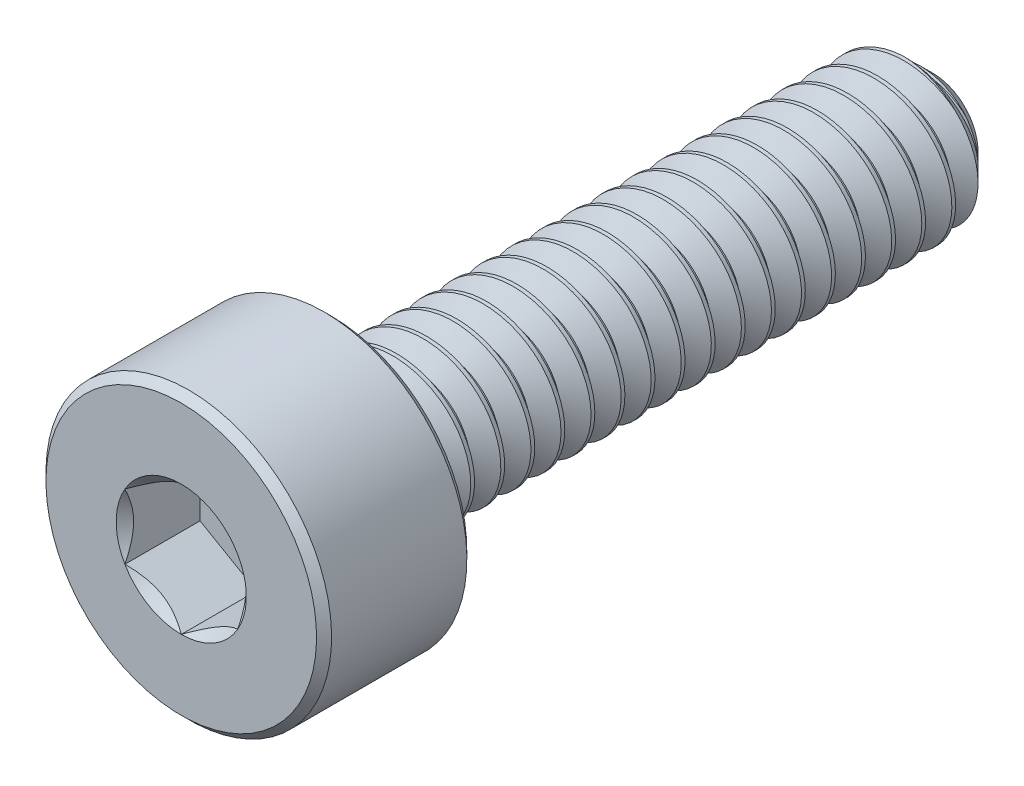
from build123d import *

# Parameters (mm, degrees)
CUT_EXTRUDE1_DEPTH = 1
CUT_SWEEP1_PITCH   = 0.4


# Read off the part's stored shape, not the designer's step: Split1, Boss-Extrude1
with BuildPart() as part:
    # Sketch2 → Revolve1 (revolve)
    with BuildSketch(Plane(origin=(0, 0, 0), x_dir=(0, 0, -1), z_dir=(1, 0, 0))):
        Polygon((-5, 0), (-5, 1.8), (-4.9, 1.9), (-3.1, 1.9), (-3, 1.8), (-3, 1), (4.6, 1), (5, 0.6), (5, 0), align=None)
    revolve(axis=Axis((0, 0, -5), (0, 0, 1)))

    # Sketch3 → Cut-Extrude1 (cut)
    with BuildSketch(Plane.XY.offset(5)):
        Polygon((0.75, -0.433012702), (0.75, 0.433012702), (0, 0.866025404), (-0.75, 0.433012702), (-0.75, -0.433012702), (0, -0.866025404), align=None)
    extrude(amount=-CUT_EXTRUDE1_DEPTH, mode=Mode.SUBTRACT)

    # Cut-Extrude2 cone 1 section (through the dimple's axis) → Cut-Extrude2 (revolve, cut)
    with BuildSketch(Plane(origin=(0, 0, 5), x_dir=(0, -1, 0), z_dir=(1, 0, 0))):
        Polygon((0, 0), (0.866025404, 0), (0, 0.866025404), align=None)
    revolve(axis=Axis((0, 0, 5), (0, 0, -1)), mode=Mode.SUBTRACT)


with BuildPart() as body_2:
    # Split1: the piece on the far side of the plane
    add(part.part)
    split(bisect_by=Plane.XY.offset(3), keep=Keep.BOTTOM)

    # Cut-Sweep1: the profile of Sketch7 screwed along a right-hand helix of 21.15 turns, 6 arcs to a turn; built about Z, then put on its axis
    cut_sweep1_z = Axis((0, 0, 0), (0, 0, 1))
    cut_sweep1_corners = [(1.021650635, 0, 0.0125), (1.021650635, 0, -0.3625), (0.740192379, 0, -0.2), (0.740192379, 0, -0.15)]
    with BuildLine(mode=Mode.PRIVATE) as cut_sweep1_profile:
        Line(cut_sweep1_corners[0], cut_sweep1_corners[1])
        Line(cut_sweep1_corners[1], cut_sweep1_corners[2])
        Line(cut_sweep1_corners[2], cut_sweep1_corners[3])
        Line(cut_sweep1_corners[3], cut_sweep1_corners[0])
    cut_sweep1_cap = Face(cut_sweep1_profile.wire())
    cut_sweep1_turn_angles = [0, 30, 60, 90, 120, 150, 180, 210, 240, 270, 300, 330, 360]
    cut_sweep1_turn_weights = [1, 0.8660254037844387, 1, 0.8660254037844387, 1, 0.8660254037844387, 1, 0.8660254037844387, 1, 0.8660254037844387, 1, 0.8660254037844387, 1]
    cut_sweep1_turn_rails = [Edge.make_bspline([Vector(p[0], p[1], 0).rotate(cut_sweep1_z, cut_sweep1_turn_angles[k]) / cut_sweep1_turn_weights[k] + Vector(0, 0, p[2] + CUT_SWEEP1_PITCH * cut_sweep1_turn_angles[k] / 360) for k in range(13)], [0, 0, 0, 1, 1, 2, 2, 3, 3, 4, 4, 5, 5, 6, 6, 6], 2, cut_sweep1_turn_weights) for p in cut_sweep1_corners]
    cut_sweep1_turn_sides = [Face.make_surface_from_curves(cut_sweep1_turn_rails[p[0]], cut_sweep1_turn_rails[p[1]]) for p in [(0, 1), (1, 2), (2, 3), (3, 0)]]
    cut_sweep1_last_angles = [7560, 7587, 7614]
    cut_sweep1_last_weights = [1, 0.8910065241884868, 1]
    cut_sweep1_last_rails = [Edge.make_bspline([Vector(p[0], p[1], 0).rotate(cut_sweep1_z, cut_sweep1_last_angles[k]) / cut_sweep1_last_weights[k] + Vector(0, 0, p[2] + CUT_SWEEP1_PITCH * cut_sweep1_last_angles[k] / 360) for k in range(3)], [0, 0, 0, 1, 1, 1], 2, cut_sweep1_last_weights) for p in cut_sweep1_corners]
    cut_sweep1_last_sides = [Face.make_surface_from_curves(cut_sweep1_last_rails[p[0]], cut_sweep1_last_rails[p[1]]) for p in [(0, 1), (1, 2), (2, 3), (3, 0)]]
    cut_sweep1 = Plane(origin=(0, 0, -5), x_dir=(0, 1, 0), z_dir=(0, 0, 1)) * Solid(Shell([*[p.moved(Location((0, 0, CUT_SWEEP1_PITCH * i))) for i in range(21) for p in cut_sweep1_turn_sides], *cut_sweep1_last_sides, cut_sweep1_cap, cut_sweep1_cap.rotate(cut_sweep1_z, 7614).moved(Location((0, 0, CUT_SWEEP1_PITCH * 7614 / 360)))]))
    add(cut_sweep1, mode=Mode.SUBTRACT)


with BuildPart() as part_1:
    add(part.part)

    # Split1
    split(bisect_by=Plane.XY.offset(3), keep=Keep.TOP)

    add(body_2.part)  # Boss-Extrude1 merges body 2
    # Boss-Extrude1 outline → Boss-Extrude1 (revolve)
    with BuildSketch(Plane.XZ):
        Polygon((0.740167909, 3), (0.740167909, 2.740167909), (1, 3), align=None)
    revolve(axis=Axis((0, 0, 0), (0, 0, 1)))


solid = part_1.part
